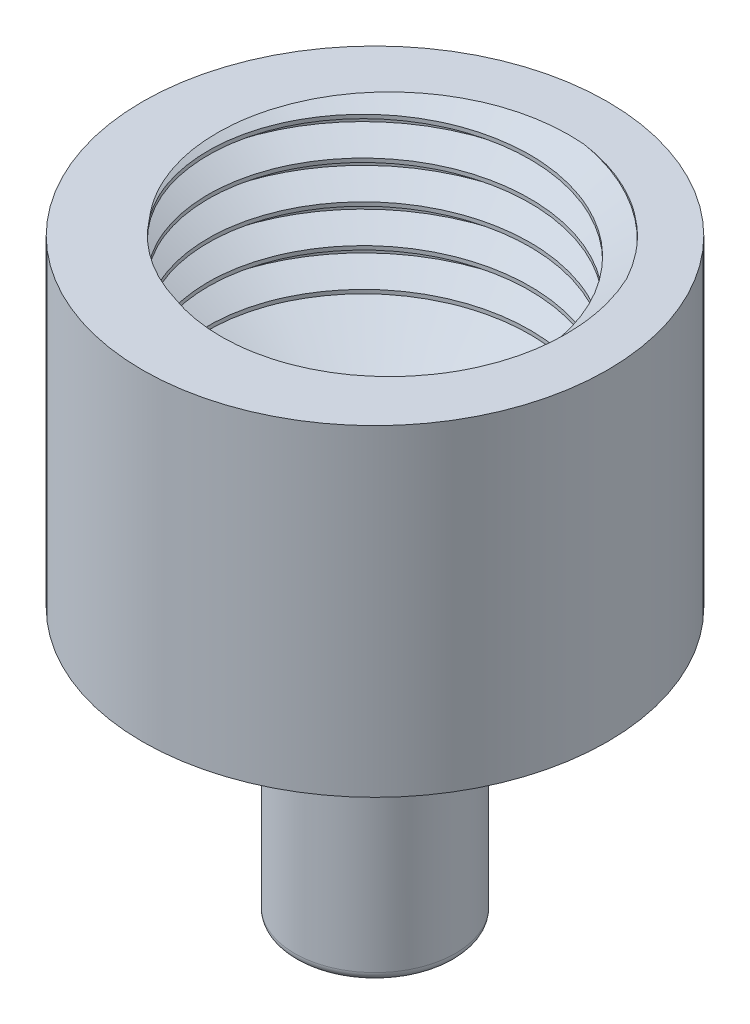
from build123d import *

# Parameters (mm, degrees)
SKETCH1_R           = 6.5
SKETCH1_R_2         = 1
BOSS_EXTRUDE1_DEPTH = 2
SKETCH2_R           = 6.5
SKETCH2_R_2         = 4.5
BOSS_EXTRUDE2_DEPTH = 7
THREAD1_PITCH       = 1.06
BOSS_EXTRUDE3_START = 7.5
SKETCH5_R           = 2.25
SKETCH5_R_2         = 1
BOSS_EXTRUDE3_DEPTH = 7.5
FILLET1_R           = 2
FILLET2_R           = 0.25


with BuildPart() as part:
    # Sketch1 → Boss-Extrude1 (new body)
    with BuildSketch(Plane(origin=(0, 0, 0), x_dir=(1, 0, 0), z_dir=(0, 1, 0))):
        with Locations(Location((0, 0, 0), (0, 0, 270))):
            Circle(SKETCH1_R)
        with Locations(Location((0, 0, 0), (0, 0, 270))):
            Circle(SKETCH1_R_2, mode=Mode.SUBTRACT)
    extrude(amount=BOSS_EXTRUDE1_DEPTH)

    # Sketch2 → Boss-Extrude2 (add)
    with BuildSketch(Plane(origin=(0, 2, 0), x_dir=(1, 0, 0), z_dir=(0, 1, 0))):
        with Locations(Location((0, 0, 0), (0, 0, 270))):
            Circle(SKETCH2_R)
        with Locations(Location((0, 0, 0), (0, 0, 270))):
            Circle(SKETCH2_R_2, mode=Mode.SUBTRACT)
    extrude(amount=BOSS_EXTRUDE2_DEPTH)

    # Thread1: the profile of Thread Profile1 profile screwed along a right-hand helix of 11.5 turns, 8 arcs to a turn; built about Z, then put on its axis
    thread1_z = Axis((0, 0, 0), (0, 0, 1))
    thread1_corners = [(4.4997, 0, -0.000173205), (5.187407661, 0, 0.396874998), (5.187407661, 0, 0.555624998), (4.4997, 0, 0.952673202)]
    with BuildLine(mode=Mode.PRIVATE) as thread1_profile:
        Line(thread1_corners[0], thread1_corners[1])
        Line(thread1_corners[1], thread1_corners[2])
        Line(thread1_corners[2], thread1_corners[3])
        Line(thread1_corners[3], thread1_corners[0])
    thread1_cap = Face(thread1_profile.wire())
    thread1_turn_angles = [0, 22.5, 45, 67.5, 90, 112.5, 135, 157.5, 180, 202.5, 225, 247.5, 270, 292.5, 315, 337.5, 360]
    thread1_turn_weights = [1, 0.9238795325112867, 1, 0.9238795325112867, 1, 0.9238795325112867, 1, 0.9238795325112867, 1, 0.9238795325112867, 1, 0.9238795325112867, 1, 0.9238795325112867, 1, 0.9238795325112867, 1]
    thread1_turn_rails = [Edge.make_bspline([Vector(p[0], p[1], 0).rotate(thread1_z, thread1_turn_angles[k]) / thread1_turn_weights[k] + Vector(0, 0, p[2] + THREAD1_PITCH * thread1_turn_angles[k] / 360) for k in range(17)], [0, 0, 0, 1, 1, 2, 2, 3, 3, 4, 4, 5, 5, 6, 6, 7, 7, 8, 8, 8], 2, thread1_turn_weights) for p in thread1_corners]
    thread1_turn_sides = [Face.make_surface_from_curves(thread1_turn_rails[p[0]], thread1_turn_rails[p[1]]) for p in [(0, 1), (1, 2), (2, 3), (3, 0)]]
    thread1_last_angles = [3960, 3982.5, 4005, 4027.5, 4050, 4072.5, 4095, 4117.5, 4140]
    thread1_last_weights = [1, 0.9238795325112867, 1, 0.9238795325112867, 1, 0.9238795325112867, 1, 0.9238795325112867, 1]
    thread1_last_rails = [Edge.make_bspline([Vector(p[0], p[1], 0).rotate(thread1_z, thread1_last_angles[k]) / thread1_last_weights[k] + Vector(0, 0, p[2] + THREAD1_PITCH * thread1_last_angles[k] / 360) for k in range(9)], [0, 0, 0, 1, 1, 2, 2, 3, 3, 4, 4, 4], 2, thread1_last_weights) for p in thread1_corners]
    thread1_last_sides = [Face.make_surface_from_curves(thread1_last_rails[p[0]], thread1_last_rails[p[1]]) for p in [(0, 1), (1, 2), (2, 3), (3, 0)]]
    thread1 = Plane(origin=(0, 2, 0), x_dir=(1, 0, 0), z_dir=(0, 1, 0)) * Solid(Shell([*[p.moved(Location((0, 0, THREAD1_PITCH * i))) for i in range(11) for p in thread1_turn_sides], *thread1_last_sides, thread1_cap, thread1_cap.rotate(thread1_z, 4140).moved(Location((0, 0, THREAD1_PITCH * 4140 / 360)))]))
    add(thread1, mode=Mode.SUBTRACT)

    # Sketch5 → Boss-Extrude3 (add)
    with BuildSketch(Plane.XZ.offset(BOSS_EXTRUDE3_START)):
        with Locations(Location((0, 0, 0), (0, 0, 90))):
            Circle(SKETCH5_R)
        with Locations(Location((0, 0, 0), (0, 0, 270))):
            Circle(SKETCH5_R_2, mode=Mode.SUBTRACT)
    extrude(amount=-BOSS_EXTRUDE3_DEPTH)

    # Fillet1
    fillet1_edges = [part.edges().sort_by_distance(p)[0] for p in [
        (0, 0, -2.25),
    ]]
    fillet(fillet1_edges, radius=FILLET1_R)

    # Fillet2
    fillet2_edges = [part.edges().sort_by_distance(p)[0] for p in [
        (0, -7.5, -2.25),
    ]]
    fillet(fillet2_edges, radius=FILLET2_R)

    # Sketch6 → Revolve1 (revolve)
    with BuildSketch(Plane(origin=(0, 0, 0), x_dir=(0, 0, -1), z_dir=(1, 0, 0)), mode=Mode.PRIVATE) as revolve1_sk:
        Polygon((-1, 2), (-6.5, 5.175426481), (-6.5, 0), (-1, 0), align=None)
    revolve(revolve1_sk.sketch.rotate(Axis((0, 13, 0), (0, -1, 0)), 180), axis=Axis((0, 13, 0), (0, -1, 0)))


solid = part.part
